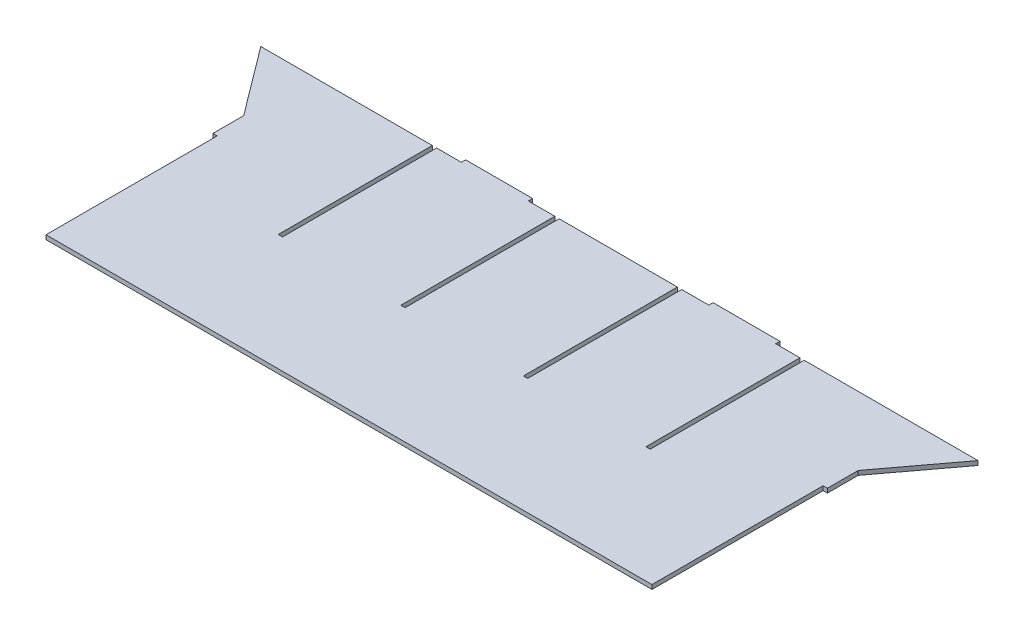
from build123d import *

# Parameters (mm, degrees)
SKETCH1_W           = 455.9320066
SKETCH1_H           = 3.175
BOSS_EXTRUDE1_DEPTH = 200.6419914
SKETCH2_W           = 3.175
SKETCH2_H           = 114.3
CUT_EXTRUDE1_DEPTH  = 304.703454044
LPATTERN1_COUNT     = 4
LPATTERN1_PITCH     = 90.932
SKETCH3_W           = 49.658811606
SKETCH3_H           = 3.175
BOSS_EXTRUDE2_DEPTH = 3.175
BOSS_EXTRUDE3_DEPTH = 3.175
SKETCH5_W           = 3.175
SKETCH5_H           = 127
CUT_EXTRUDE2_DEPTH  = 3.175


with BuildPart() as part:
    # Sketch1 → Boss-Extrude1 (new body)
    with BuildSketch(Plane.XY):
        Rectangle(SKETCH1_W, SKETCH1_H)
    extrude(amount=BOSS_EXTRUDE1_DEPTH)

    # Sketch2 → Cut-Extrude1 (cut, through all)
    with BuildSketch(Plane(origin=(0, 1.5875, 0), x_dir=(1, 0, 0), z_dir=(0, 1, 0))):
        with Locations((135.5735033, -57.15)):
            Rectangle(SKETCH2_W, SKETCH2_H)
    cut_extrude1 = extrude(amount=-CUT_EXTRUDE1_DEPTH, mode=Mode.SUBTRACT)

    # LPattern1: Cut-Extrude1 ×4
    with Locations(*[(-i * LPATTERN1_PITCH, 0, 0) for i in range(1, LPATTERN1_COUNT)]):
        add(cut_extrude1, mode=Mode.SUBTRACT)

    # Sketch3 → Boss-Extrude2 (add)
    with BuildSketch(Plane(origin=(0, 0, 0), x_dir=(-1, 0, 0), z_dir=(0, 0, -1))):
        with Locations((-91.136597497, 0)):
            Rectangle(SKETCH3_W, SKETCH3_H)
        with Locations((92.427590897, 0)):
            Rectangle(SKETCH3_W, SKETCH3_H)
    extrude(amount=BOSS_EXTRUDE2_DEPTH)

    # Sketch4 → Boss-Extrude3 (add)
    with BuildSketch(Plane.XZ.offset(1.5875)):
        Polygon((-227.9660033, 0), (-266.0660033, 0), (-227.9660033, 50.8), align=None)
    boss_extrude3 = extrude(amount=-BOSS_EXTRUDE3_DEPTH)

    # Mirror1: Boss-Extrude3 across plane
    add(boss_extrude3.mirror(Plane(origin=(0, 0, 0), x_dir=(0, 0, 1), z_dir=(1, 0, 0))))

    # Sketch5 → Cut-Extrude2 (cut)
    with BuildSketch(Plane.XZ.offset(1.5875)):
        with Locations((-226.3785033, 137.1419914)):
            Rectangle(SKETCH5_W, SKETCH5_H)
    cut_extrude2 = extrude(amount=-CUT_EXTRUDE2_DEPTH, mode=Mode.SUBTRACT)

    # Mirror2: Cut-Extrude2 across plane
    add(cut_extrude2.mirror(Plane(origin=(0, 0, 0), x_dir=(0, 0, 1), z_dir=(1, 0, 0))), mode=Mode.SUBTRACT)


solid = part.part
